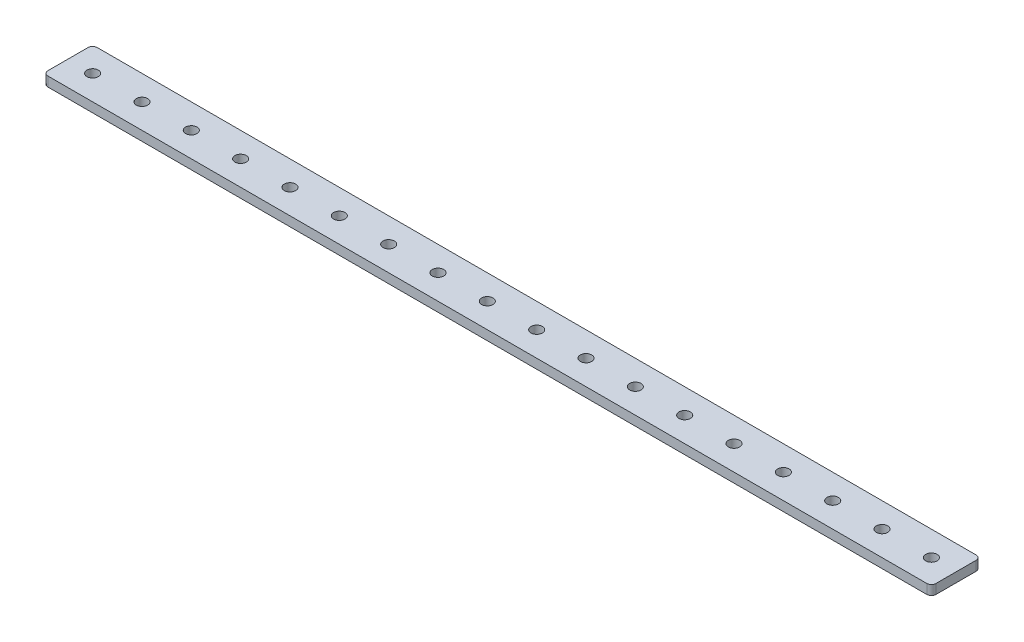
from build123d import *

# Parameters (mm, degrees)
SKETCH1_W           = 288
SKETCH1_H           = 16
BOSS_EXTRUDE1_DEPTH = 3.1
SKETCH2_R           = 1.85
CUT_EXTRUDE1_DEPTH  = 145.255363852
FILLET1_R           = 1.5


with BuildPart() as part:
    # Sketch1 → Boss-Extrude1 (new body)
    with BuildSketch(Plane(origin=(0, 0, 0), x_dir=(1, 0, 0), z_dir=(0, 1, 0))):
        Rectangle(SKETCH1_W, SKETCH1_H)
    extrude(amount=BOSS_EXTRUDE1_DEPTH)

    # Sketch2 → Cut-Extrude1 (cut, through all)
    with BuildSketch(Plane(origin=(0, 3.1, 0), x_dir=(1, 0, 0), z_dir=(0, 1, 0))):
        with Locations((-136, 0)):
            Circle(SKETCH2_R)
        with Locations((-120, 0)):
            Circle(SKETCH2_R)
        with Locations((-104, 0)):
            Circle(SKETCH2_R)
        with Locations((-88, 0)):
            Circle(SKETCH2_R)
        with Locations((-72, 0)):
            Circle(SKETCH2_R)
        with Locations((-56, 0)):
            Circle(SKETCH2_R)
        with Locations((-40, 0)):
            Circle(SKETCH2_R)
        with Locations((-24, 0)):
            Circle(SKETCH2_R)
        with Locations((-8, 0)):
            Circle(SKETCH2_R)
        with Locations((8, 0)):
            Circle(SKETCH2_R)
        with Locations((24, 0)):
            Circle(SKETCH2_R)
        with Locations((40, 0)):
            Circle(SKETCH2_R)
        with Locations((56, 0)):
            Circle(SKETCH2_R)
        with Locations((72, 0)):
            Circle(SKETCH2_R)
        with Locations((88, 0)):
            Circle(SKETCH2_R)
        with Locations((104, 0)):
            Circle(SKETCH2_R)
        with Locations((120, 0)):
            Circle(SKETCH2_R)
        with Locations((136, 0)):
            Circle(SKETCH2_R)
    extrude(amount=-CUT_EXTRUDE1_DEPTH, mode=Mode.SUBTRACT)

    # Fillet1
    fillet1_edges = [part.edges().sort_by_distance(p)[0] for p in [
        (144, 1.55, 8),
        (-144, 1.55, 8),
        (-144, 1.55, -8),
        (144, 1.55, -8),
    ]]
    fillet(fillet1_edges, radius=FILLET1_R)


solid = part.part
